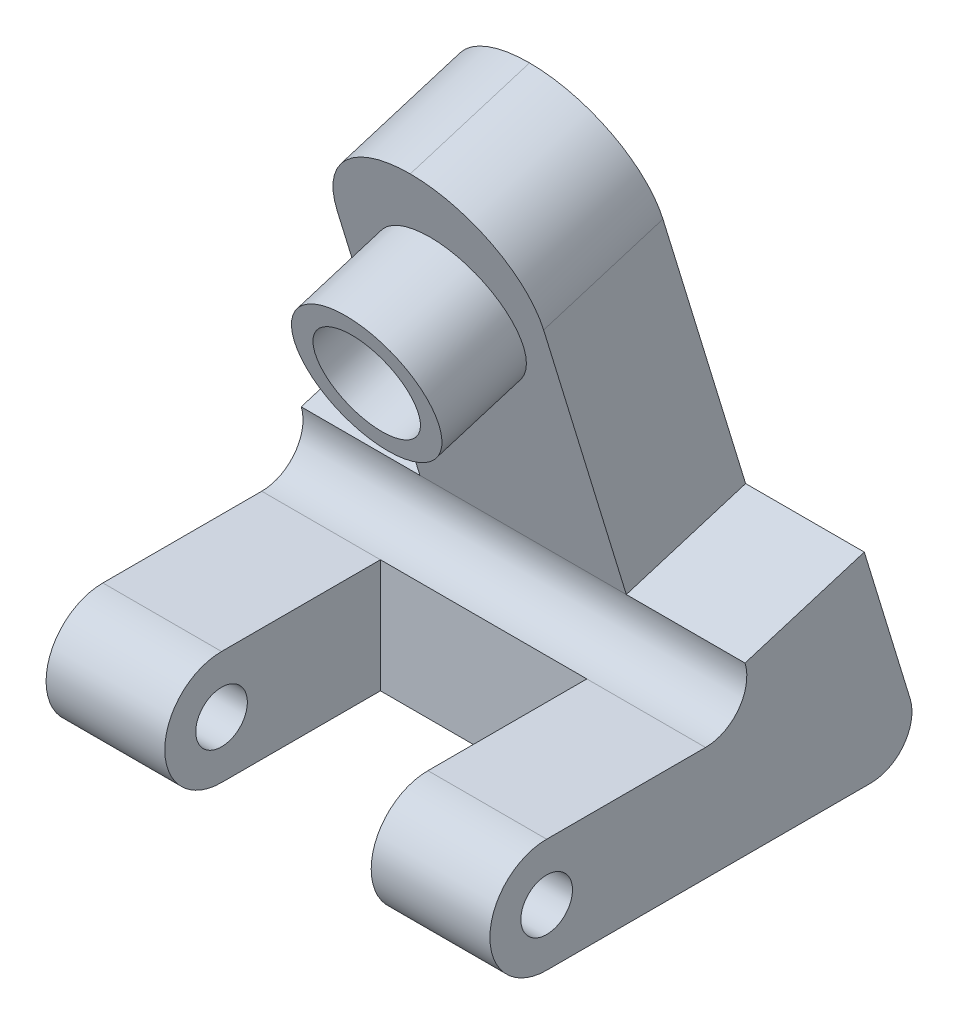
from build123d import *

# Parameters (mm, degrees)
SKETCH1_R                      = 1.5875
BOSS_EXTRUDE1_DEPTH            = 27.305
FILLET1_R                      = 2.54
CUT_EXTRUDE1_REACH             = 49.512
SKETCH2_W                      = 12.7
SKETCH2_H                      = 10.26762413
CUT_EXTRUDE1_DIRECTION_2_DEPTH = 48.511945714
SKETCH3_R                      = 4.445
SKETCH3_R_2                    = 3.175
BOSS_EXTRUDE2_DEPTH            = 5.43375
SKETCH4_R                      = 3.4925
CUT_EXTRUDE2_DEPTH             = 7.673839963
CUT_EXTRUDE3_DEPTH             = 7.3025
CUT_EXTRUDE4_DEPTH             = 7.3025
BOSS_EXTRUDE3_DEPTH            = 12.7
FILLET2_R                      = 6.35


with BuildPart() as part:
    # Sketch1 → Boss-Extrude1 (new body)
    with BuildSketch(Plane(origin=(0, 0, 0), x_dir=(0, 0, -1), z_dir=(1, 0, 0))):
        with BuildLine():
            Line((0, 3.4925), (13.208, 3.4925))
            Line((13.208, 3.4925), (5.261420462, 29.48459049))
            Line((5.261420462, 29.48459049), (12.599950115, 31.728204162))
            Line((12.599950115, 31.728204162), (23.368, -3.4925))
            Line((23.368, -3.4925), (0, -3.4925))
            ThreePointArc((0, -3.4925), (-3.4925, 0), (0, 3.4925))
        make_face()
        Circle(SKETCH1_R, mode=Mode.SUBTRACT)
    extrude(amount=BOSS_EXTRUDE1_DEPTH)

    # Fillet1
    fillet1_edges = [part.edges().sort_by_distance(p)[0] for p in [
        (13.6525, 3.4925, -13.208),
        (13.6525, -3.4925, -23.368),
    ]]
    fillet(fillet1_edges, radius=FILLET1_R)

    # Cut-Extrude1: up to this plane
    cut_extrude1_end = Plane(origin=(27.305, 3.4925, -13.208), z_dir=(0, 0.292371704722731, -0.9563047559630373))
    # Sketch2 → Cut-Extrude1 (cut, up to the surface)
    with BuildSketch(Plane.XY, mode=Mode.PRIVATE) as cut_extrude1_sk1:
        with Locations((13.6525, 1.641312065)):
            Rectangle(SKETCH2_W, SKETCH2_H)
    cut_extrude1_tool1 = split(extrude(cut_extrude1_sk1.sketch, amount=-CUT_EXTRUDE1_REACH, mode=Mode.PRIVATE), bisect_by=cut_extrude1_end, keep=Keep.BOTH, mode=Mode.PRIVATE)
    add(cut_extrude1_tool1.solids().sort_by_distance((13.6525, 1.641312, 0))[0], mode=Mode.SUBTRACT)

    # Sketch2 → Cut-Extrude1 direction 2 (cut)
    with BuildSketch(Plane.XY):
        with Locations((13.6525, 1.641312065)):
            Rectangle(SKETCH2_W, SKETCH2_H)
    extrude(amount=CUT_EXTRUDE1_DIRECTION_2_DEPTH, mode=Mode.SUBTRACT)

    # Sketch3 → Boss-Extrude2 (add)
    with BuildSketch(Plane(origin=(0, 3.991453073, -13.055454737), x_dir=(1, 0, 0), z_dir=(0, -0.2923717047227311, 0.9563047559630372))):
        with Locations(Location((13.6525, 18.054125632, 0), (0, 0, 90))):
            Circle(SKETCH3_R)
        with Locations(Location((13.6525, 18.054125632, 0), (0, 0, 270))):
            Circle(SKETCH3_R_2, mode=Mode.SUBTRACT)
    extrude(amount=BOSS_EXTRUDE2_DEPTH)

    # Sketch4 → Cut-Extrude2 (cut)
    with BuildSketch(Plane(origin=(0, 3.991453073, -13.055454737), x_dir=(1, 0, 0), z_dir=(0, -0.29237170472273094, 0.9563047559630372))):
        with Locations(Location((13.6525, 18.054125632, 0), (0, 0, 270))):
            Circle(SKETCH4_R)
    extrude(amount=-CUT_EXTRUDE2_DEPTH, mode=Mode.SUBTRACT)

    # Sketch5 → Cut-Extrude3 (cut)
    with BuildSketch(Plane.ZY):
        Polygon((-12.599950115, 31.728204162), (-5.261420462, 29.48459049), (-12.204401088, 6.77512413), (-19.542930741, 9.018737802), align=None)
    extrude(amount=-CUT_EXTRUDE3_DEPTH, mode=Mode.SUBTRACT)

    # Sketch6 → Cut-Extrude4 (cut)
    with BuildSketch(Plane(origin=(27.305, 0, 0), x_dir=(0, 0, -1), z_dir=(1, 0, 0))):
        Polygon((12.599950115, 31.728204162), (5.261420462, 29.48459049), (12.204401088, 6.77512413), (19.542930741, 9.018737802), align=None)
    extrude(amount=-CUT_EXTRUDE4_DEPTH, mode=Mode.SUBTRACT)

    # Sketch7 → Boss-Extrude3 (add)
    with BuildSketch(Plane.ZY.offset(-20.0025)):
        with BuildLine():
            Line((-9.775387008, 3.4925), (-9.775387008, -3.4925))
            Line((-9.775387008, -3.4925), (-15.34352881, -3.4925))
            Line((-15.34352881, -3.4925), (-12.204401088, 6.77512413))
            ThreePointArc((-12.204401088, 6.77512413), (-11.817183434, 4.521650122), (-9.775387008, 3.4925))
        make_face()
    extrude(amount=BOSS_EXTRUDE3_DEPTH)

    # Fillet2
    fillet2_edges = [part.edges().sort_by_distance(p)[0] for p in [
        (20.0025, 30.606397326, -8.930685288),
        (7.3025, 30.606397326, -8.930685288),
    ]]
    fillet(fillet2_edges, radius=FILLET2_R - 0.0001)  # a hair under: the kernel refuses the full size


solid = part.part
